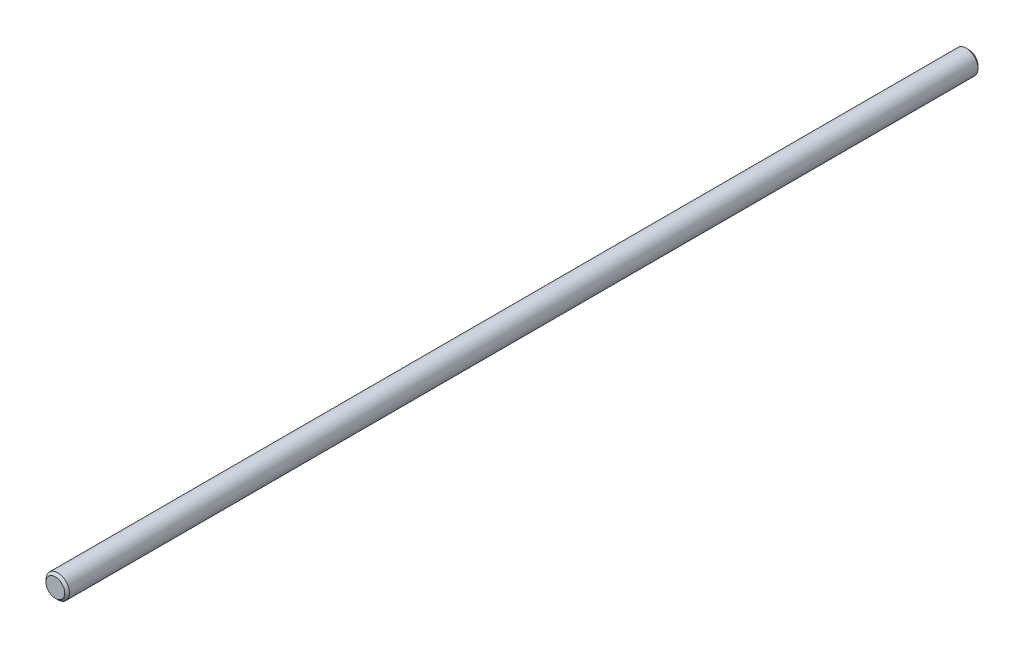
from build123d import *

# Parameters (mm, degrees)
SCHIZZO1_R                   = 5
ESTRUSIONE_ESTRUSIONE1_DEPTH = 390
SMUSSO1_SIZE                 = 1


with BuildPart() as part:
    # Schizzo1 → Estrusione-Estrusione1 (new body)
    with BuildSketch(Plane.XY):
        Circle(SCHIZZO1_R)
    extrude(amount=ESTRUSIONE_ESTRUSIONE1_DEPTH)

    # Smusso1
    smusso1_edges = [part.edges().sort_by_distance(p)[0] for p in [
        (-5, 0, 390),
        (-5, 0, 0),
    ]]
    chamfer(smusso1_edges, length=SMUSSO1_SIZE)


solid = part.part
